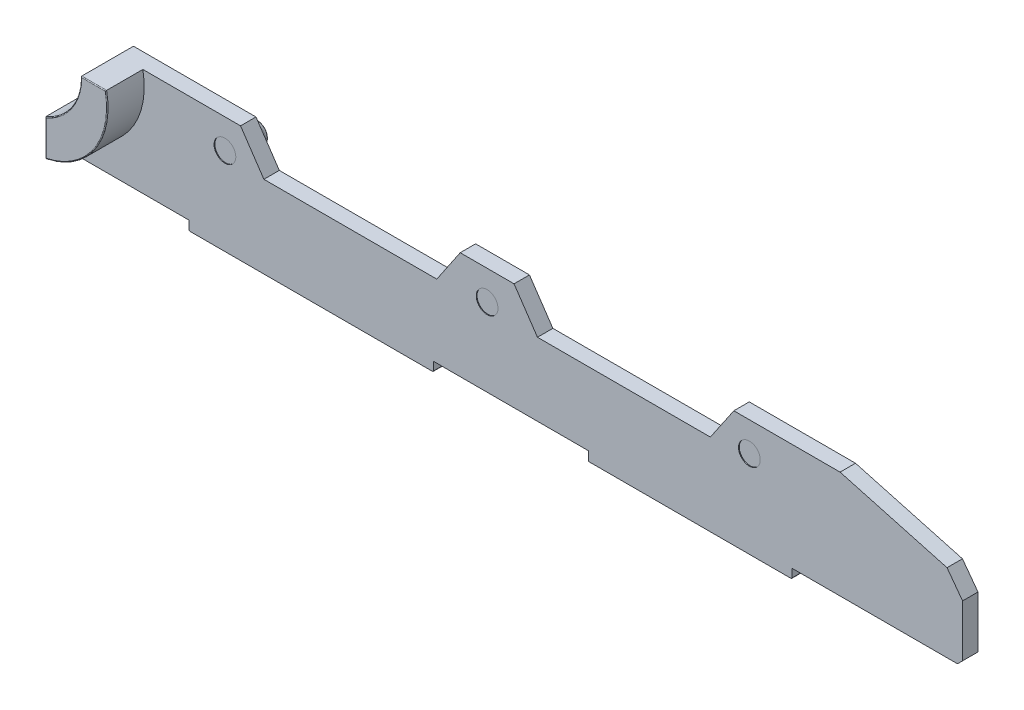
from build123d import *

# Parameters (mm, degrees)
BOSS_EXTRUDE1_DEPTH  = 2
SKETCH6_W            = 31.7
SKETCH6_H            = 1.1999999999999997
BOSS_EXTRUDE2_DEPTH  = 1.2
BOSS_EXTRUDE3_DEPTH  = 1.2
SKETCH4_R            = 1.4099999999999993
SKETCH4_R_2          = 1.4100000000000028
SKETCH4_R_3          = 1.409999999999999
CUT_EXTRUDE6_DEPTH   = 0.1
BOSS_EXTRUDE11_DEPTH = 4.8
SHELL10_DEPTH        = 0.8
SHELL10_START        = 0.8
SHELL10_2_DEPTH      = 4.8
SHELL10_3_OUTLINE_R  = 2.61
SHELL10_3_DEPTH      = 0.7
FILLET2_R            = 2
BOSS_EXTRUDE12_DEPTH = 0.5
SKETCH27_R           = 1.5000000000000042
BOSS_EXTRUDE13_DEPTH = 3
FILLET3_R            = 0.5
SKETCH32_R           = 1.4999999999999973
BOSS_EXTRUDE14_DEPTH = 3
FILLET4_R            = 0.5
SKETCH33_R           = 1.5000000000000009
BOSS_EXTRUDE15_DEPTH = 3
FILLET5_R            = 0.5
SKETCH34_R           = 0.49999999999999917
CUT_EXTRUDE7_DEPTH   = 3
SKETCH35_R           = 0.49999999999999917
CUT_EXTRUDE8_DEPTH   = 3
SKETCH36_R           = 0.49999999999999917
CUT_EXTRUDE9_DEPTH   = 3
FILLET7_R            = 0.1
FILLET8_R            = 0.1
FILLET9_R            = 0.1
FILLET10_R           = 0.1
FILLET11_R           = 0.1


with BuildPart() as part:
    # Sketch1 → Boss-Extrude1 (new body)
    with BuildSketch(Plane.XY):
        with BuildLine():
            Line((0, 0), (113.56, 0))
            Line((113.56, 0), (114.2246801189894, 0.6646806296412225))
            Line((114.2246801189894, 0.6646806296412225), (114.2246801189894, 7.4046806296412235))
            Line((114.2246801189894, 7.4046806296412235), (112.20627968421682, 10.128324324324318))
            Line((112.20627968421682, 10.128324324324318), (98.32468037431536, 13.93))
            Line((98.32468037431536, 13.93), (84.53468037431537, 13.930000000000003))
            Line((84.53468037431537, 13.930000000000003), (81.48697297298213, 9.450000000000003))
            Line((81.48697297298213, 9.450000000000003), (59.046972972982125, 9.450000000000003))
            Line((59.046972972982125, 9.450000000000003), (56.00756633365256, 13.93758367953171))
            Line((56.00756633365256, 13.93758367953171), (49.017566333652546, 13.938836362308603))
            Line((49.017566333652546, 13.938836362308603), (45.980010060525075, 9.450000000000003))
            Line((45.980010060525075, 9.450000000000003), (23.54001006052507, 9.450000000000003))
            Line((23.54001006052507, 9.450000000000003), (20.510017262013168, 13.94394522006733))
            Line((20.510017262013168, 13.94394522006733), (4.610017262013166, 13.946794670160694))
            ThreePointArc((4.610017262013166, 13.946794670160694), (3.3495085223409222, 9.824096158647764), (-8e-17, 7.11))
            Line((-8e-17, 7.11), (0, 0))
        make_face()
    extrude(amount=BOSS_EXTRUDE1_DEPTH)

    # Sketch6 → Boss-Extrude2 (add)
    with BuildSketch(Plane.XZ):
        with Locations((29.68, 1.4000000000000001)):
            Rectangle(SKETCH6_W, SKETCH6_H)
    extrude(amount=BOSS_EXTRUDE2_DEPTH)

    # Sketch7 → Boss-Extrude3 (add)
    with BuildSketch(Plane(origin=(0, 0, 0), x_dir=(-1, 0, 0), z_dir=(0, -1, 0))):
        Polygon((-65.68, -2), (-92.06, -2), (-92.06, -0.8000000000000034), (-65.68, -0.8000000000000002), align=None)
    extrude(amount=BOSS_EXTRUDE3_DEPTH)

    # Sketch4 → Cut-Extrude6 (cut)
    with BuildSketch(Plane.XY.offset(2)):
        with Locations((52.51248680065845, 10.128209973991437)):
            Circle(SKETCH4_R)
        with Locations((18.483506653624264, 10.134308331265466)):
            Circle(SKETCH4_R_2)
        with Locations((86.55081658593453, 10.120000000000001)):
            Circle(SKETCH4_R_3)
    extrude(amount=-CUT_EXTRUDE6_DEPTH, mode=Mode.SUBTRACT)

    # Sketch18 → Boss-Extrude11 (add)
    with BuildSketch(Plane.XY.offset(2)):
        with BuildLine():
            Line((4.610017262013166, 13.946794670160694), (7.8300172620131665, 13.946217611714113))
            ThreePointArc((7.8300172620131665, 13.946217611714113), (6.3125217988837115, 6.53645913408641), (8.7e-16, 2.3700000000000006))
            Line((8.7e-16, 2.3700000000000006), (8.7e-16, 7.110000000000001))
            ThreePointArc((8.7e-16, 7.110000000000001), (3.3495085223409227, 9.824096158647766), (4.610017262013166, 13.946794670160694))
        make_face()
    extrude(amount=BOSS_EXTRUDE11_DEPTH)

    # Shell10: read off the stored shape, not the designer's step
    # Shell10 outline → Shell10 (cut)
    # profile 1 of 4: a face of its own
    with BuildSketch(Plane.XY):
        with BuildLine():
            Line((52.512954541, 12.738209932), (49.654387443, 12.738722218))
            Line((49.654387443, 12.738722218), (46.61690841, 8.25))
            Line((46.61690841, 8.25), (22.901816113, 8.25))
            Line((22.901816113, 8.25), (20.647565145, 11.593400804))
            ThreePointArc((20.647565145, 11.593400804), (20.979532762, 10.89716721), (21.093506654, 10.134308331))
            ThreePointArc((21.093506654, 10.134308331), (16.637792591, 8.288925011), (18.483974394, 12.744308289))
            Line((18.483974394, 12.744308289), (6.783010982, 12.746405227))
            ThreePointArc((6.783010982, 12.746405227), (5.456630529, 7.419449569), (1.2, 3.952918417))
            Line((1.2, 3.952918417), (1.2, 1.2))
            Line((1.2, 1.2), (113.024680119, 1.2))
            Line((113.024680119, 1.2), (113.024680119, 7.008505085))
            Line((113.024680119, 7.008505085), (111.489175152, 9.080526251))
            Line((111.489175152, 9.080526251), (98.163332392, 12.73))
            Line((98.163332392, 12.73), (86.550816586, 12.73))
            ThreePointArc((86.550816586, 12.73), (88.396365285, 11.965548699), (89.160816586, 10.12))
            ThreePointArc((89.160816586, 10.12), (85.782780654, 7.625562026), (84.392831293, 11.588059766))
            Line((84.392831293, 11.588059766), (82.121976504, 8.25))
            Line((82.121976504, 8.25), (58.410391633, 8.25))
            Line((58.410391633, 8.25), (55.37090773, 12.737697756))
            Line((55.37090773, 12.737697756), (52.512954541, 12.738209932))
        make_face()
        with BuildLine():
            ThreePointArc((55.122486801, 10.128209974), (50.666772738, 8.282826654), (52.512954541, 12.738209932))
            ThreePointArc((52.512954541, 12.738209932), (54.358200863, 11.973593294), (55.122486801, 10.128209974))
        make_face(mode=Mode.SUBTRACT)
    # profile 2 of 4: a face of its own
    with BuildSketch(Plane.XY):
        with BuildLine():
            ThreePointArc((18.483974394, 12.744308289), (19.709247434, 12.438578181), (20.647565145, 11.593400804))
            Line((20.647565145, 11.593400804), (19.871746204, 12.744059586))
            Line((19.871746204, 12.744059586), (18.483974394, 12.744308289))
        make_face()
    # profile 3 of 4: a face of its own
    with BuildSketch(Plane.XY):
        with BuildLine():
            Line((85.169683906, 12.73), (84.392831293, 11.588059766))
            ThreePointArc((84.392831293, 11.588059766), (85.330065995, 12.426917422), (86.550816586, 12.73))
            Line((86.550816586, 12.73), (85.169683906, 12.73))
        make_face()
    # profile 4 of 4: a face of its own
    with BuildSketch(Plane.XY):
        with BuildLine():
            ThreePointArc((1.2, 3.952918417), (5.456630529, 7.419449569), (6.783010982, 12.746405227))
            Line((6.783010982, 12.746405227), (5.725437473, 12.746594756))
            ThreePointArc((5.725437473, 12.746594756), (4.237190705, 8.997855303), (1.2, 6.34391511))
            Line((1.2, 6.34391511), (1.2, 3.952918417))
        make_face()
    extrude(amount=SHELL10_DEPTH, mode=Mode.SUBTRACT)

    # Shell10 2 outline → Shell10 2 (cut)
    with BuildSketch(Plane.XY.offset(SHELL10_START)):
        with BuildLine():
            ThreePointArc((1.2, 3.952918417), (5.456630529, 7.419449569), (6.783010982, 12.746405227))
            Line((6.783010982, 12.746405227), (5.725437473, 12.746594756))
            ThreePointArc((5.725437473, 12.746594756), (4.237190705, 8.997855303), (1.2, 6.34391511))
            Line((1.2, 6.34391511), (1.2, 3.952918417))
        make_face()
    extrude(amount=SHELL10_2_DEPTH, mode=Mode.SUBTRACT)

    # Shell10 3 outline → Shell10 3 (cut)
    with BuildSketch(Plane.XY):
        with Locations((52.512486801, 10.128209974)):
            Circle(SHELL10_3_OUTLINE_R)
        with Locations((18.483506654, 10.134308331)):
            Circle(SHELL10_3_OUTLINE_R)
        with Locations((86.550816586, 10.12)):
            Circle(SHELL10_3_OUTLINE_R)
    extrude(amount=SHELL10_3_DEPTH, mode=Mode.SUBTRACT)

    # Fillet2
    fillet2_edges = [part.edges().sort_by_distance(p)[0] for p in [
        (5.456630529005078, 7.419449569008004, 0.8),
    ]]
    fillet(fillet2_edges, radius=FILLET2_R)

    # Sketch19 → Boss-Extrude12 (add)
    with BuildSketch(Plane(origin=(0, 0, 0.8000000000000002), x_dir=(-1, 0, 0), z_dir=(0, 0, -1))):
        with BuildLine():
            Line((-112.10465013060012, 8.250000000000004), (-113.0246801189894, 7.008505084706755))
            Line((-113.0246801189894, 7.008505084706755), (-7.532233645801631, 7.008505084706755))
            ThreePointArc((-7.532233645801631, 7.008505084706755), (-7.836772464238917, 7.620143611633395), (-8.101586568073918, 8.250000000000004))
            Line((-8.101586568073918, 8.250000000000004), (-112.10465013060012, 8.250000000000004))
        make_face()
    extrude(amount=BOSS_EXTRUDE12_DEPTH)

    # Sketch27 → Boss-Extrude13 (add)
    with BuildSketch(Plane(origin=(0, 0, 0.7000000000000001), x_dir=(-1, 0, 0), z_dir=(0, 0, -1))):
        with Locations(Location((-52.51248680065845, 10.128209973991437, 0), (0, 0, 180))):
            Circle(SKETCH27_R)
    extrude(amount=BOSS_EXTRUDE13_DEPTH)

    # Fillet3
    fillet3_edges = [part.edges().sort_by_distance(p)[0] for p in [
        (51.01248680065844, 10.128209973991437, -2.3),
    ]]
    fillet(fillet3_edges, radius=FILLET3_R)

    # Sketch32 → Boss-Extrude14 (add)
    with BuildSketch(Plane(origin=(0, 0, 0.7000000000000001), x_dir=(-1, 0, 0), z_dir=(0, 0, -1))):
        with Locations(Location((-86.55081658593453, 10.120000000000001, 0), (0, 0, 180))):
            Circle(SKETCH32_R)
    extrude(amount=BOSS_EXTRUDE14_DEPTH)

    # Fillet4
    fillet4_edges = [part.edges().sort_by_distance(p)[0] for p in [
        (85.05081658593453, 10.120000000000001, -2.3),
    ]]
    fillet(fillet4_edges, radius=FILLET4_R)

    # Sketch33 → Boss-Extrude15 (add)
    with BuildSketch(Plane(origin=(0, 0, 0.7000000000000001), x_dir=(-1, 0, 0), z_dir=(0, 0, -1))):
        with Locations(Location((-18.483506653624264, 10.134308331265466, 0), (0, 0, 180))):
            Circle(SKETCH33_R)
    extrude(amount=BOSS_EXTRUDE15_DEPTH)

    # Fillet5
    fillet5_edges = [part.edges().sort_by_distance(p)[0] for p in [
        (16.983506653624264, 10.134308331265466, -2.3),
    ]]
    fillet(fillet5_edges, radius=FILLET5_R)

    # Sketch34 → Cut-Extrude7 (cut)
    with BuildSketch(Plane(origin=(0, 0, -2.3), x_dir=(-1, 0, 0), z_dir=(0, 0, -1))):
        with Locations((-52.51248680065845, 10.128209973991437)):
            Circle(SKETCH34_R)
    extrude(amount=-CUT_EXTRUDE7_DEPTH, mode=Mode.SUBTRACT)

    # Sketch35 → Cut-Extrude8 (cut)
    with BuildSketch(Plane(origin=(0, 0, -2.3), x_dir=(-1, 0, 0), z_dir=(0, 0, -1))):
        with Locations((-18.483506653624264, 10.134308331265466)):
            Circle(SKETCH35_R)
    extrude(amount=-CUT_EXTRUDE8_DEPTH, mode=Mode.SUBTRACT)

    # Sketch36 → Cut-Extrude9 (cut)
    with BuildSketch(Plane(origin=(0, 0, -2.3), x_dir=(-1, 0, 0), z_dir=(0, 0, -1))):
        with Locations((-86.55081658593453, 10.120000000000001)):
            Circle(SKETCH36_R)
    extrude(amount=-CUT_EXTRUDE9_DEPTH, mode=Mode.SUBTRACT)

    # Fillet7
    fillet7_edges = [part.edges().sort_by_distance(p)[0] for p in [
        (3.3495085223409236, 9.824096158647766, 6.8),
        (8.7e-16, 4.74, 6.8),
        (6.312521798883712, 6.536459134086408, 6.8),
        (6.220017262013166, 13.946506140937403, 6.8),
    ]]
    fillet(fillet7_edges, radius=FILLET7_R)

    # Fillet8
    fillet8_edges = [part.edges().sort_by_distance(p)[0] for p in [
        (13.83, -1.2, 1.4),
    ]]
    fillet(fillet8_edges, radius=FILLET8_R)

    # Fillet9
    fillet9_edges = [part.edges().sort_by_distance(p)[0] for p in [
        (92.06, -1.2, 1.4000000000000017),
    ]]
    fillet(fillet9_edges, radius=FILLET9_R)

    # Fillet10
    fillet10_edges = [part.edges().sort_by_distance(p)[0] for p in [
        (65.68, -1.2, 1.4),
    ]]
    fillet(fillet10_edges, radius=FILLET10_R)

    # Fillet11
    fillet11_edges = [part.edges().sort_by_distance(p)[0] for p in [
        (45.53, -1.2, 1.4000000000000001),
    ]]
    fillet(fillet11_edges, radius=FILLET11_R)


solid = part.part
